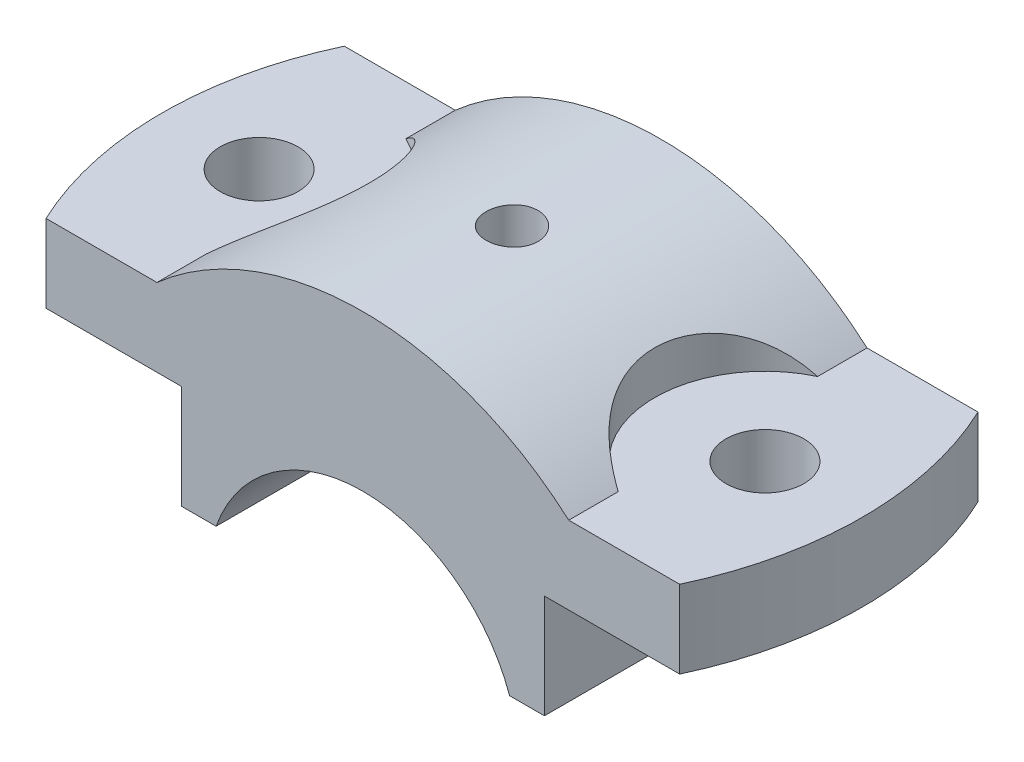
from build123d import *

# Parameters (mm, degrees)
BOSS_EXTRUDE1_DEPTH = 23
CUT_EXTRUDE1_START  = 24
CUT_EXTRUDE1_DEPTH  = 12
SKETCH5_R           = 6
CUT_EXTRUDE2_DEPTH  = 76.822160349
SKETCH6_R           = 17
CUT_EXTRUDE3_DEPTH  = 46
SKETCH10_R          = 4
CUT_EXTRUDE6_DEPTH  = 20
SKETCH11_R          = 3
CUT_EXTRUDE7_DEPTH  = 63.681735814


# Read off the part's stored shape, not the designer's step: Cut-Extrude1
with BuildPart() as part:
    # Sketch1 → Boss-Extrude1 (new, symmetric)
    with BuildSketch(Plane.XY):
        with BuildLine():
            Line((-22.627416998, 8), (-28, 8))
            Line((-28, 8), (-28, 24))
            Line((-28, 24), (-54, 24))
            Line((-54, 24), (-54, 36))
            Line((-54, 36), (-31.749015733, 36))
            ThreePointArc((-31.749015733, 36), (0, 48), (31.749015733, 36))
            Line((31.749015733, 36), (54, 36))
            Line((54, 36), (54, 24))
            Line((54, 24), (28, 24))
            Line((28, 24), (28, 8))
            Line((28, 8), (22.627416998, 8))
            ThreePointArc((22.627416998, 8), (0, 24), (-22.627416998, 8))
        make_face()
    extrude(amount=BOSS_EXTRUDE1_DEPTH, both=True)

    # Cut-Extrude1 outline → Cut-Extrude1 (cut)
    with BuildSketch(Plane(origin=(0, 0, 0), x_dir=(1, 0, 0), z_dir=(0, 1, 0)).offset(CUT_EXTRUDE1_START)):
        with BuildLine():
            Line((-54, -23), (-48.856934001, -23))
            ThreePointArc((-48.856934001, -23), (-52.698550436, -11.784005345), (-54, 0))
            Line((-54, 0), (-54, -23))
        make_face()
        with BuildLine():
            Line((-54, 23), (-54, 0))
            ThreePointArc((-54, 0), (-52.698550436, 11.784005345), (-48.856934001, 23))
            Line((-48.856934001, 23), (-54, 23))
        make_face()
        with BuildLine():
            ThreePointArc((54, 0), (52.698550436, -11.784005345), (48.856934001, -23))
            Line((48.856934001, -23), (54, -23))
            Line((54, -23), (54, 0))
        make_face()
        with BuildLine():
            ThreePointArc((48.856934001, 23), (52.698550436, 11.784005345), (54, 0))
            Line((54, 0), (54, 23))
            Line((54, 23), (48.856934001, 23))
        make_face()
    extrude(amount=CUT_EXTRUDE1_DEPTH, mode=Mode.SUBTRACT)

    # Sketch5 → Cut-Extrude2 (cut, through all)
    with BuildSketch(Plane(origin=(0, 0, 0), x_dir=(1, 0, 0), z_dir=(0, 1, 0))):
        with Locations(Location((-39, 0, 0), (0, 0, 90))):
            Circle(SKETCH5_R)
        with Locations(Location((39, 0, 0), (0, 0, 90))):
            Circle(SKETCH5_R)
    extrude(amount=CUT_EXTRUDE2_DEPTH, mode=Mode.SUBTRACT)

    # Sketch6 → Cut-Extrude3 (cut)
    with BuildSketch(Plane(origin=(0, 36, 0), x_dir=(1, 0, 0), z_dir=(0, 1, 0))):
        with Locations((-39, 0)):
            Circle(SKETCH6_R)
        with Locations((39, 0)):
            Circle(SKETCH6_R)
    extrude(amount=CUT_EXTRUDE3_DEPTH, mode=Mode.SUBTRACT)

    # Sketch10 → Cut-Extrude6 (cut)
    with BuildSketch(Plane(origin=(0, 50, 0), x_dir=(1, 0, 0), z_dir=(0, 1, 0))):
        with Locations(Location((0, 0, 0), (0, 0, 270))):
            Circle(SKETCH10_R)
    extrude(amount=-CUT_EXTRUDE6_DEPTH, mode=Mode.SUBTRACT)

    # Sketch11 → Cut-Extrude7 (cut, through all)
    with BuildSketch(Plane(origin=(0, 30, 0), x_dir=(1, 0, 0), z_dir=(0, 1, 0))):
        with Locations(Location((0, 0, 0), (0, 0, 270))):
            Circle(SKETCH11_R)
    extrude(amount=-CUT_EXTRUDE7_DEPTH, mode=Mode.SUBTRACT)


solid = part.part
